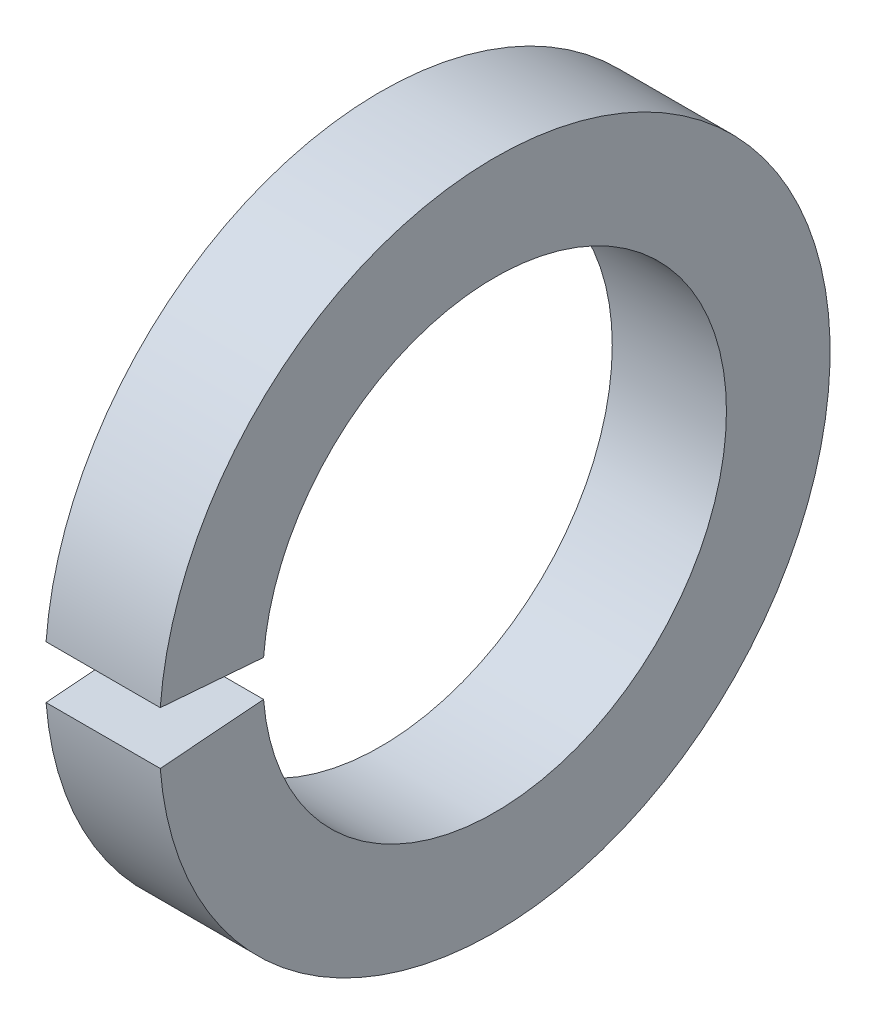
from build123d import *

# Parameters (mm, degrees)
SKETCH1_W = 6.35
SKETCH1_H = 5.7658
GAP_DEPTH = 28.137383061


with BuildPart() as part:
    # Sketch1 → Base-Revolve (revolve)
    with BuildSketch(Plane.XY):
        with Locations((-3.175, 15.7734)):
            Rectangle(SKETCH1_W, SKETCH1_H)
    revolve(axis=Axis((-34.925, 0, 0), (1, 0, 0)))

    # Sketch2 → Gap (cut, through all)
    with BuildSketch(Plane(origin=(0, 0, 0), x_dir=(0, -1, 0), z_dir=(-1, 0, 0))):
        with BuildLine():
            Line((0, 0), (1.493031556, 18.97076463))
            ThreePointArc((1.493031556, 18.97076463), (0, 19.029426), (-1.493031556, 18.97076463))
            Line((-1.493031556, 18.97076463), (0, 0))
        make_face()
    extrude(amount=GAP_DEPTH, mode=Mode.SUBTRACT)


solid = part.part
